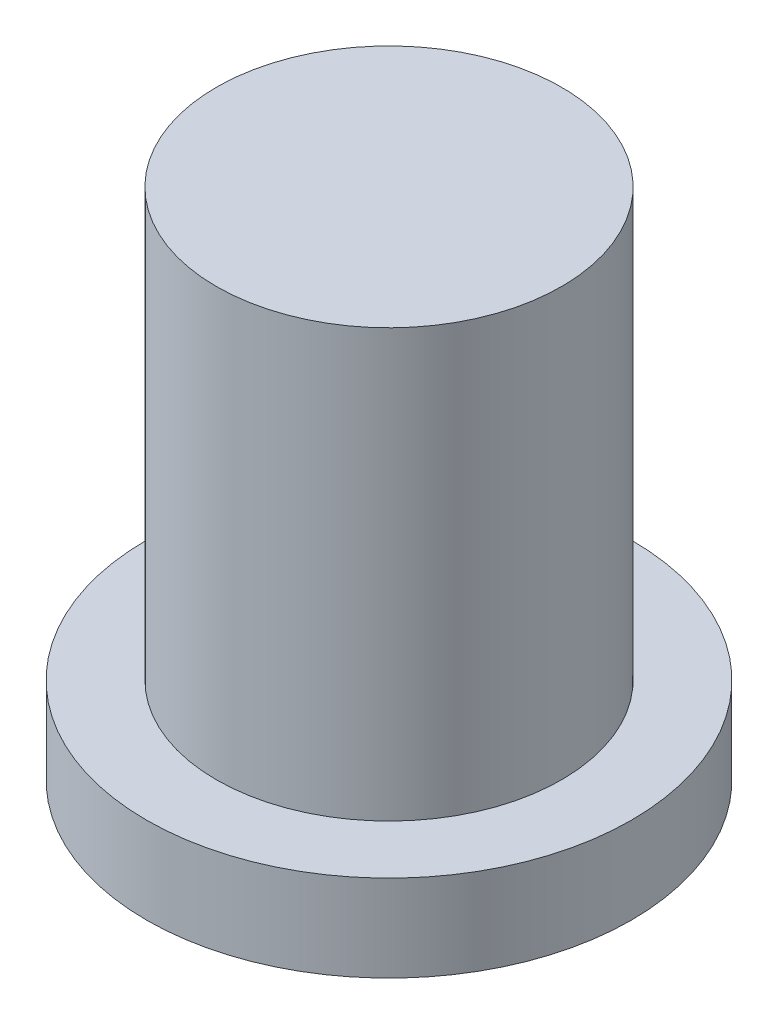
from build123d import *

# Parameters (mm, degrees)
CROQUIS1_R                 = 21
SALIENTE_EXTRUIR1_DEPTH    = 7.5
CROQUIS2_R                 = 14.95
SALIENTE_EXTRUIR2_DEPTH    = 37
CORTAR_EXTRUIR1_DEPTH      = 54.5
CORTAR_EXTRUIR1_DEPTH_BACK = 2.5
CORTAR_EXTRUIR2_DEPTH      = 52.439284598
CORTAR_EXTRUIR2_DEPTH_BACK = 1.5
CROQUIS4_R                 = 5.5


with BuildPart() as part:
    # Croquis1 → Saliente-Extruir1 (new body)
    with BuildSketch(Plane(origin=(0, 0, 0), x_dir=(1, 0, 0), z_dir=(0, 1, 0))):
        Circle(CROQUIS1_R)
    extrude(amount=SALIENTE_EXTRUIR1_DEPTH)

    # Croquis2 → Saliente-Extruir2 (add)
    with BuildSketch(Plane(origin=(0, 7.5, 0), x_dir=(1, 0, 0), z_dir=(0, 1, 0))):
        Circle(CROQUIS2_R)
    extrude(amount=SALIENTE_EXTRUIR2_DEPTH)

    # Croquis3 → Cortar-Extruir1 (cut, two sides: drawn at the far end of the back side and taken through both)
    with BuildSketch(Plane.XZ.offset(-CORTAR_EXTRUIR1_DEPTH_BACK)):
        with BuildLine():
            Line((-4.971667622, -4.813784484), (-7.886808716, -5.156697725))
            Line((-7.886808716, -5.156697725), (-17.496587444, -4.741948795))
            ThreePointArc((-17.496587444, -4.741948795), (-20.06167777, -2.359890899), (-18.11936882, 0.552380405))
            Line((-18.11936882, 0.552380405), (-8.868149486, 3.18578214))
            Line((-8.868149486, 3.18578214), (-5.953008392, 3.528695381))
            ThreePointArc((-5.953008392, 3.528695381), (-5.084547102, 4.014240505), (-4.813784484, 4.971667622))
            Line((-4.813784484, 4.971667622), (-5.156697725, 7.886808716))
            Line((-5.156697725, 7.886808716), (-4.741948795, 17.496587444))
            ThreePointArc((-4.741948795, 17.496587444), (-2.359890899, 20.06167777), (0.552380405, 18.11936882))
            Line((0.552380405, 18.11936882), (3.18578214, 8.868149486))
            Line((3.18578214, 8.868149486), (3.528695381, 5.953008392))
            ThreePointArc((3.528695381, 5.953008392), (4.014240505, 5.084547102), (4.971667622, 4.813784484))
            Line((4.971667622, 4.813784484), (7.886808716, 5.156697725))
            Line((7.886808716, 5.156697725), (17.496587444, 4.741948795))
            ThreePointArc((17.496587444, 4.741948795), (20.06167777, 2.359890899), (18.11936882, -0.552380405))
            Line((18.11936882, -0.552380405), (8.868149486, -3.18578214))
            Line((8.868149486, -3.18578214), (5.953008392, -3.528695381))
            ThreePointArc((5.953008392, -3.528695381), (5.084547102, -4.014240505), (4.813784484, -4.971667622))
            Line((4.813784484, -4.971667622), (5.156697725, -7.886808716))
            Line((5.156697725, -7.886808716), (4.741948795, -17.496587444))
            ThreePointArc((4.741948795, -17.496587444), (2.359890899, -20.06167777), (-0.552380405, -18.11936882))
            Line((-0.552380405, -18.11936882), (-3.18578214, -8.868149486))
            Line((-3.18578214, -8.868149486), (-3.528695381, -5.953008392))
            ThreePointArc((-3.528695381, -5.953008392), (-4.014240505, -5.084547102), (-4.971667622, -4.813784484))
        make_face()
    extrude(amount=CORTAR_EXTRUIR1_DEPTH + CORTAR_EXTRUIR1_DEPTH_BACK, mode=Mode.SUBTRACT)

    # Croquis4 → Cortar-Extruir2 (cut, two sides: drawn at the far end of the back side and taken through both)
    with BuildSketch(Plane.XZ.offset(-2.5).offset(-CORTAR_EXTRUIR2_DEPTH_BACK)):
        Circle(CROQUIS4_R)
    extrude(amount=CORTAR_EXTRUIR2_DEPTH + CORTAR_EXTRUIR2_DEPTH_BACK, mode=Mode.SUBTRACT)


solid = part.part
